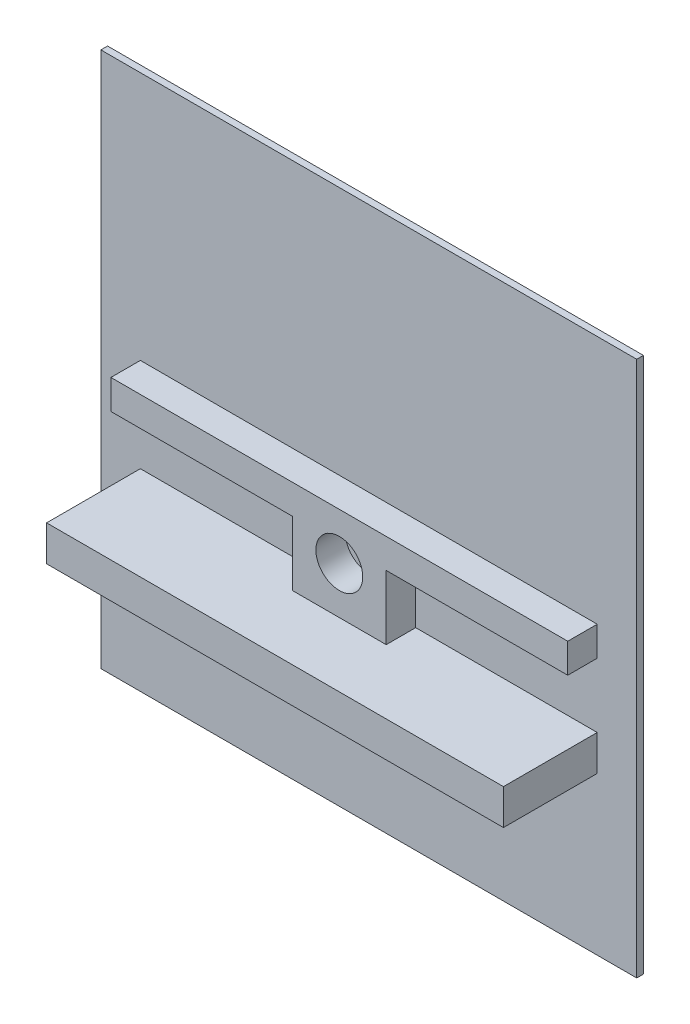
from build123d import *

# Parameters (mm, degrees)
ESQUISSE1_W        = 400
ESQUISSE1_H        = 400
BOSS_EXTRU_1_DEPTH = 5
ESQUISSE2_R        = 17.5
BOSS_EXTRU_2_DEPTH = 22
ESQUISSE3_W        = 341.033953396
ESQUISSE3_H        = 26.482613147
BOSS_EXTRU_3_DEPTH = 70


with BuildPart() as part:
    # Esquisse1 → Boss.-Extru.1 (new body)
    with BuildSketch(Plane.XY):
        with Locations((200, 200)):
            Rectangle(ESQUISSE1_W, ESQUISSE1_H)
    extrude(amount=-BOSS_EXTRU_1_DEPTH)

    # Esquisse2 → Boss.-Extru.2 (add)
    with BuildSketch(Plane.XY):
        Polygon((29.483023302, 213.982774279), (29.483023302, 191.982774279), (165, 191.982774279), (165, 143.982774279), (235, 143.982774279), (235, 191.982774279), (370.516976698, 191.982774279), (370.516976698, 213.982774279), align=None)
        with Locations((200, 178.982774279)):
            Circle(ESQUISSE2_R, mode=Mode.SUBTRACT)
    extrude(amount=BOSS_EXTRU_2_DEPTH)

    # Esquisse3 → Boss.-Extru.3 (add)
    with BuildSketch(Plane.XY):
        with Locations((200, 130.741467706)):
            Rectangle(ESQUISSE3_W, ESQUISSE3_H)
    extrude(amount=BOSS_EXTRU_3_DEPTH)


solid = part.part
